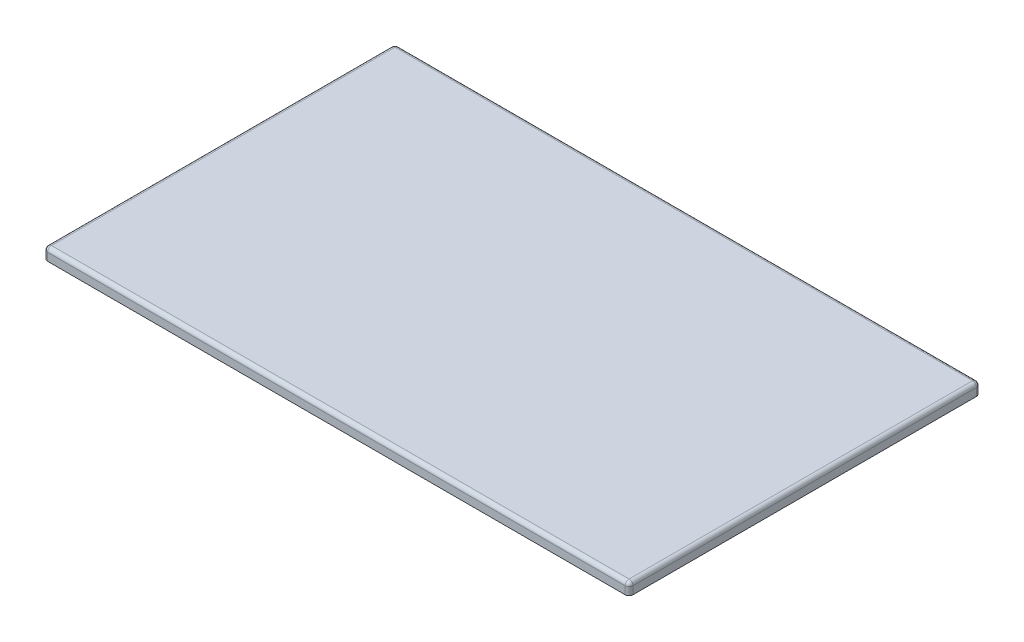
from build123d import *

# Parameters (mm, degrees)
ESQUISSE1_W             = 1500
ESQUISSE1_H             = 900
BOSS_EXTRU_1_DEPTH      = 30
CONG_1_R                = 10
CONG_2_R                = 10
ENL_V_MAT_EXTRU_1_DEPTH = 15


with BuildPart() as part:
    # Esquisse1 → Boss.-Extru.1 (new body)
    with BuildSketch(Plane(origin=(0, 0, 0), x_dir=(1, 0, 0), z_dir=(0, 1, 0))):
        with Locations((750, 450)):
            Rectangle(ESQUISSE1_W, ESQUISSE1_H)
    extrude(amount=BOSS_EXTRU_1_DEPTH)

    # Congé1
    cong_1_edges = [part.edges().sort_by_distance(p)[0] for p in [
        (1500, 30, -450),
        (750, 30, -900),
        (0, 30, -450),
        (750, 30, 0),
    ]]
    fillet(cong_1_edges, radius=CONG_1_R)

    # Congé2
    # the kernel refuses this fillet: 10 mm, written as the material it takes off along each edge
    with BuildSketch(Plane(origin=(1490, 20, -10), x_dir=(1, 0, 0), z_dir=(0, 0, 1))) as cong_2_piece_1_section:
        Polygon((0, 0), (CONG_2_R * 1.02, 0), (CONG_2_R * 1.02, CONG_2_R * 1.02), (0, CONG_2_R * 1.02), align=None)
    cong_2_piece_1 = extrude(amount=CONG_2_R * 1.02, mode=Mode.PRIVATE)
    cong_2_piece_1 = cong_2_piece_1 - Plane(origin=(1490, 20, -10), x_dir=(-0.7071067811865475, -0.7071067811865475, 0), z_dir=(0, 0, 1)) * Sphere(CONG_2_R, mode=Mode.PRIVATE)
    add(cong_2_piece_1, mode=Mode.SUBTRACT)
    with BuildSketch(Plane(origin=(10, 20, -10), x_dir=(-1, 0, 0), z_dir=(0, 0, 1))) as cong_2_piece_2_section:
        Polygon((0, 0), (CONG_2_R * 1.02, 0), (CONG_2_R * 1.02, -CONG_2_R * 1.02), (0, -CONG_2_R * 1.02), align=None)
    cong_2_piece_2 = extrude(amount=CONG_2_R * 1.02, mode=Mode.PRIVATE)
    cong_2_piece_2 = cong_2_piece_2 - Plane(origin=(10, 20, -10), x_dir=(0.7071067811865475, -0.7071067811865475, 0), z_dir=(0, 0, 1)) * Sphere(CONG_2_R, mode=Mode.PRIVATE)
    add(cong_2_piece_2, mode=Mode.SUBTRACT)
    with BuildSketch(Plane(origin=(1490, 20, -890), x_dir=(0, 0, -1), z_dir=(1, 0, 0))) as cong_2_piece_3_section:
        Polygon((0, 0), (CONG_2_R * 1.02, 0), (CONG_2_R * 1.02, CONG_2_R * 1.02), (0, CONG_2_R * 1.02), align=None)
    cong_2_piece_3 = extrude(amount=CONG_2_R * 1.02, mode=Mode.PRIVATE)
    cong_2_piece_3 = cong_2_piece_3 - Plane(origin=(1490, 20, -890), x_dir=(0, -0.7071067811865475, 0.7071067811865475), z_dir=(1, 0, 0)) * Sphere(CONG_2_R, mode=Mode.PRIVATE)
    add(cong_2_piece_3, mode=Mode.SUBTRACT)
    with BuildSketch(Plane(origin=(10, 20, -890), x_dir=(0, 0, -1), z_dir=(-1, 0, 0))) as cong_2_piece_4_section:
        Polygon((0, 0), (CONG_2_R * 1.02, 0), (CONG_2_R * 1.02, -CONG_2_R * 1.02), (0, -CONG_2_R * 1.02), align=None)
    cong_2_piece_4 = extrude(amount=CONG_2_R * 1.02, mode=Mode.PRIVATE)
    cong_2_piece_4 = cong_2_piece_4 - Plane(origin=(10, 20, -890), x_dir=(0, -0.7071067811865475, 0.7071067811865475), z_dir=(-1, 0, 0)) * Sphere(CONG_2_R, mode=Mode.PRIVATE)
    add(cong_2_piece_4, mode=Mode.SUBTRACT)
    with BuildSketch(Plane(origin=(0, -25, -900), x_dir=(0, 0, 1), z_dir=(0, 1, 0)), Plane(origin=(0, -25, 0), x_dir=(1, 0, 0), z_dir=(0, 1, 0))) as cong_2_piece_5:
        with BuildLine():
            CenterArc((CONG_2_R, CONG_2_R), CONG_2_R, 180, 90)
            Line((0, CONG_2_R), (0, 0))
            Line((0, 0), (CONG_2_R, 0))
        make_face()
    extrude(amount=45, mode=Mode.SUBTRACT)
    with BuildSketch(Plane(origin=(1500, -25, -900), x_dir=(0, 0, 1), z_dir=(0, 1, 0)), Plane(origin=(1500, -25, 0), x_dir=(-1, 0, 0), z_dir=(0, 1, 0))) as cong_2_piece_6:
        with BuildLine():
            CenterArc((CONG_2_R, -CONG_2_R), CONG_2_R, 90, 90)
            Line((0, -CONG_2_R), (0, 0))
            Line((0, 0), (CONG_2_R, 0))
        make_face()
    extrude(amount=45, mode=Mode.SUBTRACT)

    # Esquisse2 → Enlèv. mat.-Extru.1 (cut)
    with BuildSketch(Plane.XZ):
        with BuildLine():
            Line((100, -90), (150, -90))
            ThreePointArc((150, -90), (160, -100), (150, -110))
            Line((150, -110), (100, -110))
            ThreePointArc((100, -110), (90, -100), (100, -90))
        make_face()
        with BuildLine():
            Line((1400, -90), (1350, -90))
            ThreePointArc((1350, -90), (1340, -100), (1350, -110))
            Line((1350, -110), (1400, -110))
            ThreePointArc((1400, -110), (1410, -100), (1400, -90))
        make_face()
        with BuildLine():
            Line((1400, -810), (1350, -810))
            ThreePointArc((1350, -810), (1340, -800), (1350, -790))
            Line((1350, -790), (1400, -790))
            ThreePointArc((1400, -790), (1410, -800), (1400, -810))
        make_face()
        with BuildLine():
            Line((100, -810), (150, -810))
            ThreePointArc((150, -810), (160, -800), (150, -790))
            Line((150, -790), (100, -790))
            ThreePointArc((100, -790), (90, -800), (100, -810))
        make_face()
    extrude(amount=-ENL_V_MAT_EXTRU_1_DEPTH, mode=Mode.SUBTRACT)


solid = part.part
